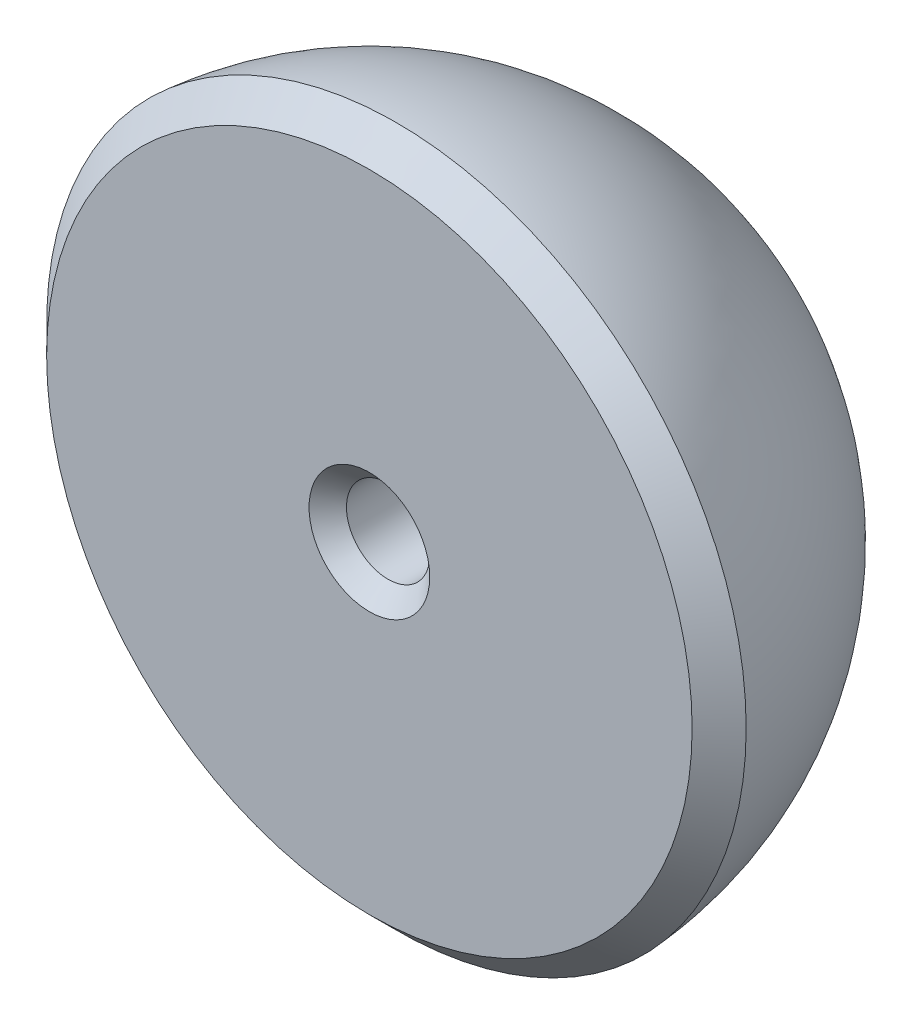
from build123d import *

# Parameters (mm, degrees)
F_4_40_TAPPED_HOLE1_D     = 2.2606
F_4_40_TAPPED_HOLE1_DEPTH = 6.35
F_4_40_TAPPED_HOLE1_TIP   = 0.679152758
FILLET1_R                 = 0.79375
CHAMFER1_SIZE             = 0.762
CHAMFER2_SIZE             = 0.508


with BuildPart() as part:
    # Sketch1 → Revolve1 (revolve)
    with BuildSketch(Plane(origin=(0, 0, 0), x_dir=(1, 0, 0), z_dir=(0, 1, 0))):
        with BuildLine():
            Line((0, 0), (0, 9.525))
            ThreePointArc((0, 9.525), (6.735192091, 6.735192091), (9.525, 0))
            Line((9.525, 0), (0, 0))
        make_face()
    revolve(axis=Axis((0, 0, 0), (0, 0, -1)))

    # #4-40 Tapped Hole1
    with Locations(Plane.XY):
        with Locations((0, 0)):
            Hole(F_4_40_TAPPED_HOLE1_D / 2, depth=F_4_40_TAPPED_HOLE1_DEPTH)
            with Locations((0, 0, -(F_4_40_TAPPED_HOLE1_DEPTH + F_4_40_TAPPED_HOLE1_TIP / 2))):  # 118° drill point
                Cone(0, F_4_40_TAPPED_HOLE1_D / 2, F_4_40_TAPPED_HOLE1_TIP, mode=Mode.SUBTRACT)

    # Fillet1
    fillet1_edges = [part.edges().sort_by_distance(p)[0] for p in [
        (0, 1.1303, -6.35),
    ]]
    fillet(fillet1_edges, radius=FILLET1_R)

    # Chamfer1
    # the kernel refuses this chamfer: 0.762 mm, written as the material it takes off along each edge
    with BuildSketch(Plane(origin=(0, 0, 0), x_dir=(1, 0, 0), z_dir=(0, 1, 0))) as chamfer1_piece_1:
        with BuildLine():
            Line((9.525 - CHAMFER1_SIZE, 0), (9.496699923, 0.733699923))
            ThreePointArc((9.496699923, 0.733699923), (9.517517871, 0.37746333), (9.525, 0))
            Line((9.525, 0), (9.525 - CHAMFER1_SIZE, 0))
        make_face()
    revolve(axis=Axis((0, 0, 0), (0, 0, -1)), mode=Mode.SUBTRACT)

    # Chamfer2
    chamfer2_edges = [part.edges().sort_by_distance(p)[0] for p in [
        (1.1303, 0, 0),
    ]]
    chamfer(chamfer2_edges, length=CHAMFER2_SIZE)


solid = part.part
